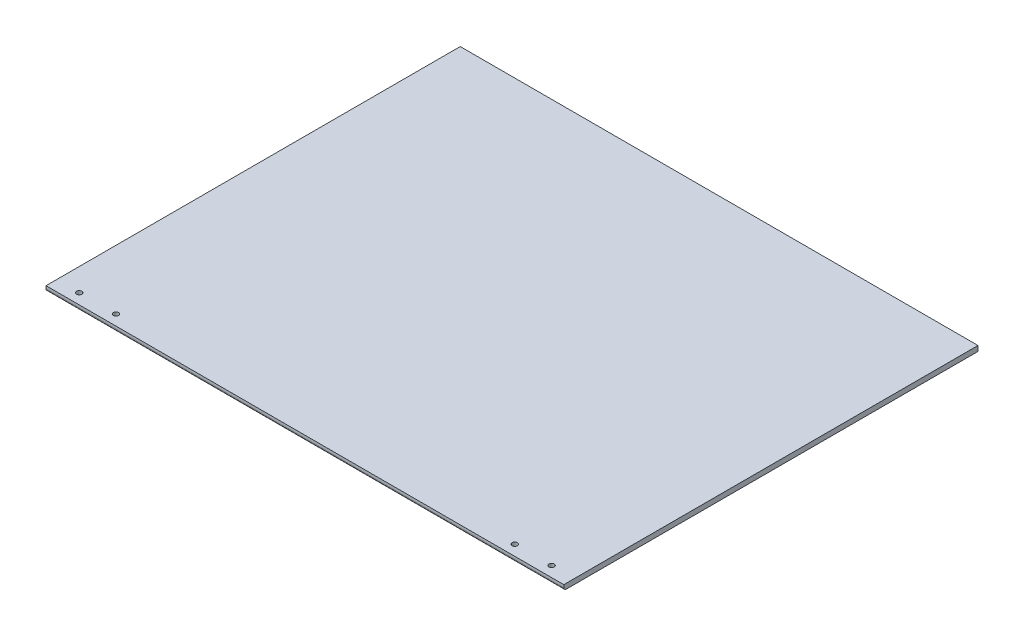
from build123d import *

# Parameters (mm, degrees)
SKETCH1_W           = 500
SKETCH1_H           = 400
BOSS_EXTRUDE1_DEPTH = 5
SKETCH3_R           = 2.54
CUT_EXTRUDE1_DEPTH  = 10
FILLET1_R           = 2.5


with BuildPart() as part:
    # Sketch1 → Boss-Extrude1 (new body)
    with BuildSketch(Plane(origin=(0, 0, 0), x_dir=(1, 0, 0), z_dir=(0, 1, 0))):
        with Locations((250, 200)):
            Rectangle(SKETCH1_W, SKETCH1_H)
    extrude(amount=BOSS_EXTRUDE1_DEPTH)

    # Sketch3 → Cut-Extrude1 (cut)
    with BuildSketch(Plane(origin=(0, 5, 0), x_dir=(1, 0, 0), z_dir=(0, 1, 0))):
        with Locations((478.0925, 10.16)):
            Circle(SKETCH3_R)
        with Locations((442.5325, 10.16)):
            Circle(SKETCH3_R)
        with Locations((21.9075, 10.16)):
            Circle(SKETCH3_R)
        with Locations((57.4675, 10.16)):
            Circle(SKETCH3_R)
    extrude(amount=-CUT_EXTRUDE1_DEPTH, mode=Mode.SUBTRACT)

    # Fillet1
    fillet1_edges = [part.edges().sort_by_distance(p)[0] for p in [
        (250, 0, 0),
    ]]
    fillet(fillet1_edges, radius=FILLET1_R)


solid = part.part
